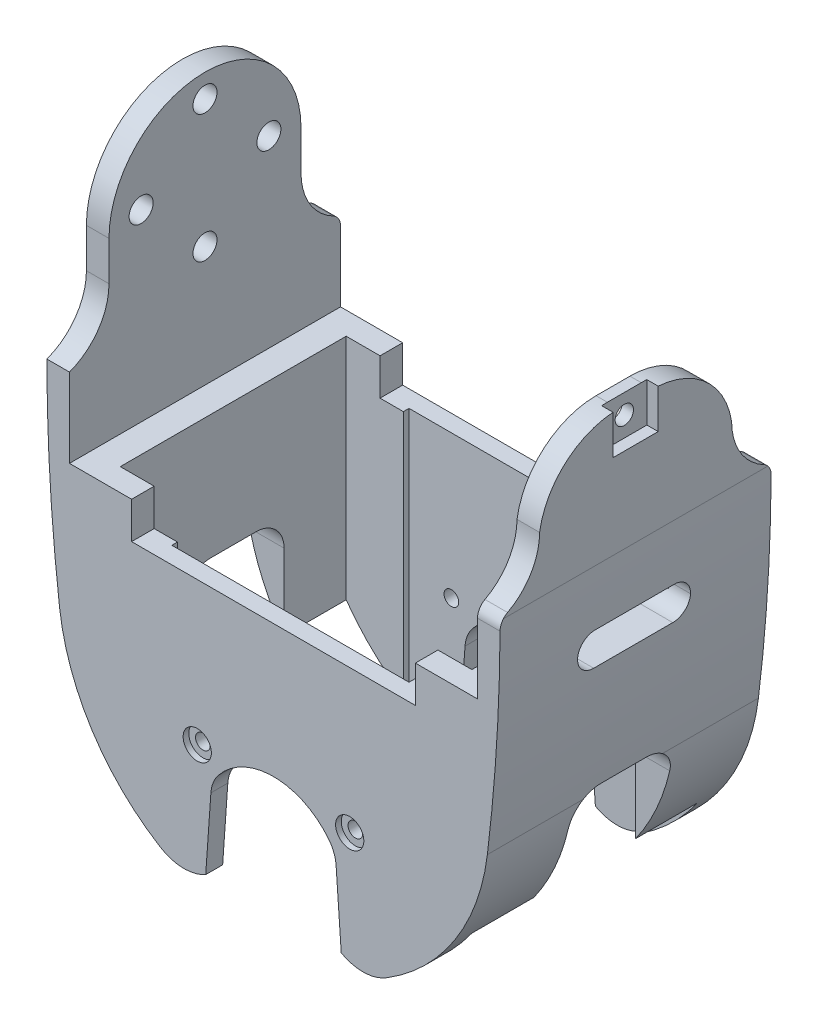
from build123d import *

# Parameters (mm, degrees)
SKETCH1_R                         = 1.3
SKETCH1_W                         = 4
SKETCH1_H                         = 26
MAIN_SHAPE_DEPTH                  = 24
SKETCH17_W                        = 50.25
SKETCH17_H                        = 20
CUT_EXTRUDE3_DEPTH                = 48
CUT_EXTRUDE2_START                = -80.25
CUT_EXTRUDE2_DEPTH                = 80.25
SKETCH8_R                         = 2.5
LOWER_MOUNTING_COUNTERBORES_DEPTH = 1
SKETCH2_W                         = 72.25
SKETCH2_H                         = 40
UPPER_HERCULEX_CUTOUT_DEPTH       = 81.476837918
BOSS_EXTRUDE3_START               = 40
BOSS_EXTRUDE3_DEPTH               = 40
SKETCH15_W                        = 42
SKETCH15_H                        = 42
LOWER_HERCULEX_CUTOUT_DEPTH       = 81.476837918
CABLE_CUTOUT_DEPTH                = 101.282149035
CUT_EXTRUDE1_REACH                = 102.282
SKETCH14_W                        = 20
SKETCH14_H                        = 6
FILLET6_R                         = 2.5
FILLET4_R                         = 3
FILLET5_R                         = 2.5
SKETCH18_R                        = 2.125
CUT_EXTRUDE4_DEPTH                = 4
CUT_EXTRUDE5_REACH                = 102.282
CUT_EXTRUDE6_REACH                = 102.282
SKETCH21_R                        = 1.625
SKETCH22_R                        = 1.625
CUT_EXTRUDE7_DEPTH                = 2
CUT_EXTRUDE9_DEPTH                = 84.393420351


# Read off the part's stored shape, not the designer's step: Cut-Extrude2
with BuildPart() as part:
    # Sketch1 → Main Shape (new, symmetric)
    # profile 1 of 3: a face of its own
    with BuildSketch(Plane.XY):
        with BuildLine():
            ThreePointArc((-20, -53.967894251), (-16.023995809, -55.138294921), (-12, -54.145367541))
            Line((-12, -54.145367541), (-11.083298375, -41.145367541))
            ThreePointArc((-11.083298375, -41.145367541), (-10.69258402, -39.398905497), (-9.804154394, -37.845367541))
            ThreePointArc((-9.804154394, -37.845367541), (0, -33.099628088), (9.804154394, -37.845367541))
            ThreePointArc((9.804154394, -37.845367541), (10.69258402, -39.398905497), (11.083298375, -41.145367541))
            Line((11.083298375, -41.145367541), (12, -54.145367541))
            ThreePointArc((12, -54.145367541), (16.023995809, -55.138294921), (20, -53.967894251))
            ThreePointArc((20, -53.967894251), (32.118391779, -42.096186902), (37.875, -26.138294921))
            ThreePointArc((37.875, -26.138294921), (39.561980934, -7.672469437), (40.125, 10.861705079))
            Line((40.125, 10.861705079), (40.125, 18.861705079))
            Line((40.125, 18.861705079), (36.125, 18.861705079))
            Line((36.125, 18.861705079), (36.125, 10.361705079))
            Line((36.125, 10.361705079), (-36.125, 10.361705079))
            Line((-36.125, 10.361705079), (-36.125, 18.861705079))
            Line((-36.125, 18.861705079), (-40.125, 18.861705079))
            Line((-40.125, 18.861705079), (-40.125, 10.861705079))
            ThreePointArc((-40.125, 10.861705079), (-39.561980934, -7.672469437), (-37.875, -26.138294921))
            ThreePointArc((-37.875, -26.138294921), (-32.118391779, -42.096186902), (-20, -53.967894251))
        make_face()
        with Locations((-13.5, -34.981279479)):
            Circle(SKETCH1_R, mode=Mode.SUBTRACT)
        with Locations((13.5, -34.981279479)):
            Circle(SKETCH1_R, mode=Mode.SUBTRACT)
    # profile 2 of 3: a face of its own
    with BuildSketch(Plane.XY):
        with Locations((-38.125, 31.861705079)):
            Rectangle(SKETCH1_W, SKETCH1_H)
    # profile 3 of 3: a face of its own
    with BuildSketch(Plane.XY):
        with Locations((38.125, 31.861705079)):
            Rectangle(SKETCH1_W, SKETCH1_H)
    extrude(amount=MAIN_SHAPE_DEPTH, both=True)

    # Sketch17 → Cut-Extrude3 (cut)
    with BuildSketch(Plane.XY.offset(24)):
        with Locations((0, 0.361705079)):
            Rectangle(SKETCH17_W, SKETCH17_H)
    extrude(amount=-CUT_EXTRUDE3_DEPTH, mode=Mode.SUBTRACT)

    # Cut-Extrude2 outline → Cut-Extrude2 (cut)
    with BuildSketch(Plane.ZY.offset(40.125).offset(CUT_EXTRUDE2_START)):
        with BuildLine():
            Line((17, 27.861705079), (17, 20.905288576))
            ThreePointArc((17, 20.905288576), (18.92265333, 14.784145516), (24, 10.861705079))
            Line((24, 10.861705079), (24, 44.861705079))
            Line((24, 44.861705079), (5.6e-08, 44.861705079))
            ThreePointArc((5.6e-08, 44.861705079), (12.0208153, 39.882520339), (17, 27.861705079))
        make_face()
        with BuildLine():
            ThreePointArc((-17, 27.861705079), (-12.02081526, 39.882520379), (5.6e-08, 44.861705079))
            Line((5.6e-08, 44.861705079), (-24, 44.861705079))
            Line((-24, 44.861705079), (-24, 10.861705079))
            ThreePointArc((-24, 10.861705079), (-18.92265333, 14.784145516), (-17, 20.905288576))
            Line((-17, 20.905288576), (-17, 27.861705079))
        make_face()
    extrude(amount=CUT_EXTRUDE2_DEPTH, mode=Mode.SUBTRACT)

    # Sketch8 → Lower Mounting Counterbores (cut)
    with BuildSketch(Plane.XY.offset(24)):
        with Locations((-13.5, -34.981279479)):
            Circle(SKETCH8_R)
        with Locations((13.5, -34.981279479)):
            Circle(SKETCH8_R)
    lower_mounting_counterbores = extrude(amount=-LOWER_MOUNTING_COUNTERBORES_DEPTH, mode=Mode.SUBTRACT)

    # Mirror1: Lower Mounting Counterbores across plane
    add(lower_mounting_counterbores.mirror(Plane.XY), mode=Mode.SUBTRACT)

    # Sketch2 → Upper Herculex Cutout (cut, through all)
    with BuildSketch(Plane(origin=(0, 10.361705079, 0), x_dir=(1, 0, 0), z_dir=(0, 1, 0))):
        Rectangle(SKETCH2_W, SKETCH2_H)
    extrude(amount=-UPPER_HERCULEX_CUTOUT_DEPTH, mode=Mode.SUBTRACT)

    # Sketch10 → Boss-Extrude3 (add)
    with BuildSketch(Plane.XY.offset(-20).offset(BOSS_EXTRUDE3_START)):
        with BuildLine():
            Line((-31.125, 10.361705079), (-36.125, 10.361705079))
            Line((-36.125, 10.361705079), (-36.125, -33.791808508))
            ThreePointArc((-36.125, -33.791808508), (-33.979280037, -38.860271588), (-31.125, -43.566280262))
            Line((-31.125, -43.566280262), (-31.125, 10.361705079))
        make_face()
        with BuildLine():
            Line((36.125, 10.361705079), (31.125, 10.361705079))
            Line((31.125, 10.361705079), (31.125, -43.566280262))
            ThreePointArc((31.125, -43.566280262), (33.979280037, -38.860271588), (36.125, -33.791808508))
            Line((36.125, -33.791808508), (36.125, 10.361705079))
        make_face()
    extrude(amount=-BOSS_EXTRUDE3_DEPTH)

    # Sketch15 → Lower Herculex Cutout (cut, through all)
    with BuildSketch(Plane.XZ.offset(-10.361705079)):
        Rectangle(SKETCH15_W, SKETCH15_H)
    extrude(amount=LOWER_HERCULEX_CUTOUT_DEPTH, mode=Mode.SUBTRACT)

    # Sketch11 → Cable Cutout (cut, through all)
    with BuildSketch(Plane(origin=(40.125, 0, 0), x_dir=(0, 0, -1), z_dir=(1, 0, 0))):
        with BuildLine():
            Line((-9, -55.140247688), (9, -55.140247688))
            Line((9, -55.140247688), (9, -30.140247688))
            ThreePointArc((9, -30.140247688), (7.535533906, -26.604713782), (4, -25.140247688))
            Line((4, -25.140247688), (-4, -25.140247688))
            ThreePointArc((-4, -25.140247688), (-7.535533906, -26.604713782), (-9, -30.140247688))
            Line((-9, -30.140247688), (-9, -55.140247688))
        make_face()
    extrude(amount=-CABLE_CUTOUT_DEPTH, mode=Mode.SUBTRACT)

    # Sketch14 → Cut-Extrude1 (cut, up to next)
    with BuildSketch(Plane(origin=(40.125, 0, 0), x_dir=(0, 0, -1), z_dir=(1, 0, 0)), mode=Mode.PRIVATE) as cut_extrude1_sk1:
        with Locations((0, -2.138294921)):
            Rectangle(SKETCH14_W, SKETCH14_H)
    cut_extrude1_tool1 = extrude(cut_extrude1_sk1.sketch, amount=-CUT_EXTRUDE1_REACH, mode=Mode.PRIVATE) & part.part
    add(cut_extrude1_tool1.solids().sort_by_distance((40.125, -2.138295, 0))[0], mode=Mode.SUBTRACT)

    # Fillet6
    fillet6_edges = [part.edges().sort_by_distance(p)[0] for p in [
        (-38.125, 10.861705079, -24),
        (38.125, 10.861705079, -24),
    ]]
    fillet(fillet6_edges, radius=FILLET6_R)

    # Fillet4
    # the kernel refuses this fillet: 3 mm, written as the material it adds along each edge
    with BuildSketch(Plane(origin=(47.205516954, -5.138294921, 10), x_dir=(0, 1, 0), z_dir=(-1, 0, 0))) as fillet4_piece_1_section:
        with BuildLine():
            CenterArc((FILLET4_R, FILLET4_R), FILLET4_R, 180, 90)
            Line((0, FILLET4_R), (0, 0))
            Line((0, 0), (FILLET4_R, 0))
        make_face()
    fillet4_piece_1 = extrude(amount=16.080516954, mode=Mode.PRIVATE)
    fillet4_piece_1 = fillet4_piece_1 & Plane(origin=(-265.222222222, 10.861705079, 9.322234556), x_dir=(0.9926313395496936, -0.12117352740504417, 0), z_dir=(0, 0, 1)) * Cylinder(305.347222222, 45, mode=Mode.PRIVATE)
    add(fillet4_piece_1)
    with BuildSketch(Plane(origin=(47.46120806, 0.861705079, 10), x_dir=(0, 0, -1), z_dir=(-1, 0, 0))) as fillet4_piece_2_section:
        with BuildLine():
            CenterArc((FILLET4_R, FILLET4_R), FILLET4_R, 180, 90)
            Line((0, FILLET4_R), (0, 0))
            Line((0, 0), (FILLET4_R, 0))
        make_face()
    fillet4_piece_2 = extrude(amount=16.33620806, mode=Mode.PRIVATE)
    fillet4_piece_2 = fillet4_piece_2 & Plane(origin=(-265.222222222, 10.861705079, 9.319818001), x_dir=(0.9926313395496936, -0.12117352740504417, 0), z_dir=(0, 0, 1)) * Cylinder(305.347222222, 45, mode=Mode.PRIVATE)
    add(fillet4_piece_2)
    with BuildSketch(Plane(origin=(47.46120806, 0.861705079, -10), x_dir=(0, -1, 0), z_dir=(-1, 0, 0))) as fillet4_piece_3_section:
        with BuildLine():
            CenterArc((FILLET4_R, FILLET4_R), FILLET4_R, 180, 90)
            Line((0, FILLET4_R), (0, 0))
            Line((0, 0), (FILLET4_R, 0))
        make_face()
    fillet4_piece_3 = extrude(amount=16.33620806, mode=Mode.PRIVATE)
    fillet4_piece_3 = fillet4_piece_3 & Plane(origin=(-265.222222222, 10.861705079, -9.319819027), x_dir=(0.9926313395496936, -0.12117352740504417, 0), z_dir=(0, 0, 1)) * Cylinder(305.347222222, 45, mode=Mode.PRIVATE)
    add(fillet4_piece_3)
    with BuildSketch(Plane(origin=(47.205516954, -5.138294921, -10), x_dir=(0, 1, 0), z_dir=(-1, 0, 0))) as fillet4_piece_4_section:
        with BuildLine():
            CenterArc((FILLET4_R, -FILLET4_R), FILLET4_R, 90, 90)
            Line((0, -FILLET4_R), (0, 0))
            Line((0, 0), (FILLET4_R, 0))
        make_face()
    fillet4_piece_4 = extrude(amount=16.080516954, mode=Mode.PRIVATE)
    fillet4_piece_4 = fillet4_piece_4 & Plane(origin=(-265.222222222, 10.861705079, -9.322234556), x_dir=(0.9926313395496936, -0.12117352740504417, 0), z_dir=(0, 0, 1)) * Cylinder(305.347222222, 45, mode=Mode.PRIVATE)
    add(fillet4_piece_4)

    # Fillet5
    fillet5_edges = [part.edges().sort_by_distance(p)[0] for p in [
        (36.125, 10.361705079, 0.130685788),
    ]]
    fillet(fillet5_edges, radius=FILLET5_R)
    fillet5_2_edges = [part.edges().sort_by_distance(p)[0] for p in [
        (37.625, 10.861705079, 24),
    ]]
    fillet(fillet5_2_edges, radius=FILLET5_R)

    # Sketch18 → Cut-Extrude4 (cut)
    with BuildSketch(Plane.ZY.offset(40.125)):
        with Locations((0, 40.736705079)):
            Circle(SKETCH18_R)
        with Locations((11.313708499, 29.42299658)):
            Circle(SKETCH18_R)
        with Locations((0, 18.109288081)):
            Circle(SKETCH18_R)
        with Locations((-11.313708499, 29.42299658)):
            Circle(SKETCH18_R)
    extrude(amount=-CUT_EXTRUDE4_DEPTH, mode=Mode.SUBTRACT)

    # Sketch20 → Cut-Extrude5 (cut, up to next)
    with BuildSketch(Plane(origin=(40.125, 0, 0), x_dir=(0, 0, -1), z_dir=(1, 0, 0)), mode=Mode.PRIVATE) as cut_extrude5_sk1:
        with BuildLine():
            Line((-3, 32.861705079), (3, 32.861705079))
            ThreePointArc((3, 32.861705079), (12.205377445, 29.465816055), (17, 20.905288576))
            Line((17, 20.905288576), (17, 27.861705079))
            ThreePointArc((17, 27.861705079), (0, 44.861705079), (-17, 27.861705079))
            Line((-17, 27.861705079), (-17, 20.905288576))
            ThreePointArc((-17, 20.905288576), (-12.205377445, 29.465816055), (-3, 32.861705079))
        make_face()
    cut_extrude5_tool1 = extrude(cut_extrude5_sk1.sketch, amount=-CUT_EXTRUDE5_REACH, mode=Mode.PRIVATE) & part.part
    add(cut_extrude5_tool1.solids().sort_by_distance((40.125, 36.10339, 0))[0], mode=Mode.SUBTRACT)

    # Sketch21 → Cut-Extrude6 (cut, up to next)
    with BuildSketch(Plane(origin=(40.125, 0, 0), x_dir=(0, 0, -1), z_dir=(1, 0, 0)), mode=Mode.PRIVATE) as cut_extrude6_sk1:
        with Locations((0, 29.42299658)):
            Circle(SKETCH21_R)
    cut_extrude6_tool1 = extrude(cut_extrude6_sk1.sketch, amount=-CUT_EXTRUDE6_REACH, mode=Mode.PRIVATE) & part.part
    add(cut_extrude6_tool1.solids().sort_by_distance((40.125, 29.422997, 0))[0], mode=Mode.SUBTRACT)

    # Sketch22 → Cut-Extrude7 (cut)
    with BuildSketch(Plane.ZY.offset(-40.125)):
        with BuildLine():
            Line((3, 32.861705079), (-3, 32.861705079))
            ThreePointArc((-3, 32.861705079), (-3.500311748, 32.852872763), (-4, 32.826386824))
            Line((-4, 32.826386824), (-4, 25.861705079))
            Line((-4, 25.861705079), (4, 25.861705079))
            Line((4, 25.861705079), (4, 32.826386824))
            ThreePointArc((4, 32.826386824), (3.500311748, 32.852872763), (3, 32.861705079))
        make_face()
        with Locations((0, 29.42299658)):
            Circle(SKETCH22_R, mode=Mode.SUBTRACT)
    extrude(amount=CUT_EXTRUDE7_DEPTH, mode=Mode.SUBTRACT)

    # Sketch24 → Cut-Extrude9 (cut, through all)
    with BuildSketch(Plane.XY.offset(24)):
        with BuildLine():
            Line((36.125, -3.138294921), (25.125, -3.138294921))
            Line((25.125, -3.138294921), (25.125, 9.248806711))
            Line((25.125, 9.248806711), (25.125, 10.361705079))
            Line((25.125, 10.361705079), (33.625, 10.361705079))
            ThreePointArc((33.625, 10.361705079), (34.79434283, 10.652036021), (35.692088535, 11.455595202))
            ThreePointArc((35.692088535, 11.455595202), (36.01432222, 12.126083348), (36.125, 12.861705079))
            Line((36.125, 12.861705079), (36.125, -3.138294921))
        make_face()
        with BuildLine():
            Line((-36.125, -3.138294921), (-25.125, -3.138294921))
            Line((-25.125, -3.138294921), (-25.125, 9.248806711))
            Line((-25.125, 9.248806711), (-25.125, 10.361705079))
            Line((-25.125, 10.361705079), (-33.625, 10.361705079))
            ThreePointArc((-33.625, 10.361705079), (-34.79434283, 10.652036021), (-35.692088535, 11.455595202))
            ThreePointArc((-35.692088535, 11.455595202), (-36.01432222, 12.126083348), (-36.125, 12.861705079))
            Line((-36.125, 12.861705079), (-36.125, -3.138294921))
        make_face()
    extrude(amount=-CUT_EXTRUDE9_DEPTH, mode=Mode.SUBTRACT)


solid = part.part
